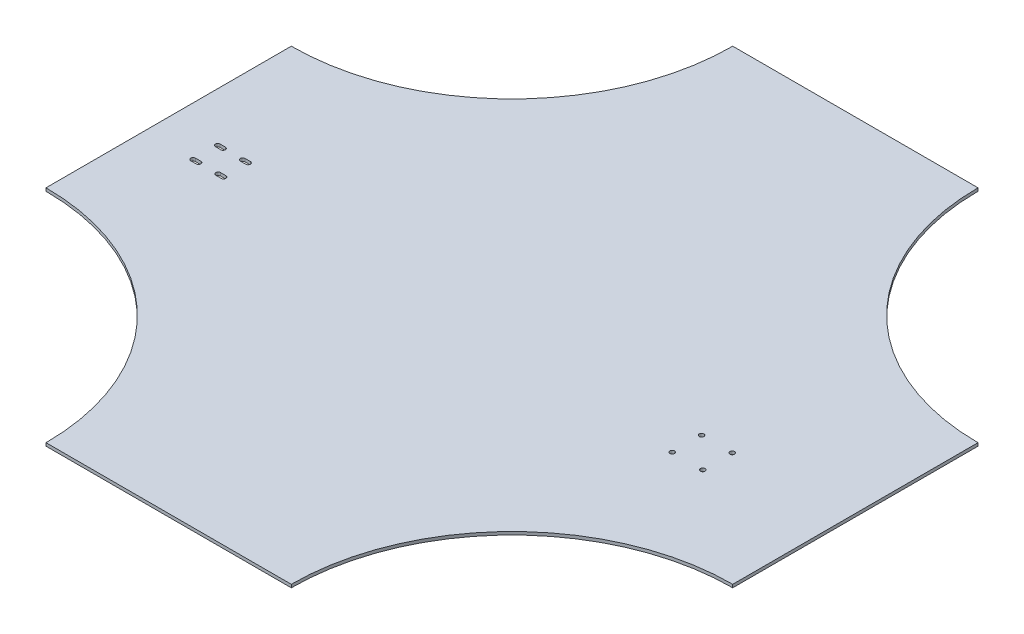
from build123d import *

# Parameters (mm, degrees)
BOSS_EXTRUDE1_DEPTH     = 3.175
CUT_EXTRUDE1_DEPTH      = 503.904365287
CUT_EXTRUDE1_DEPTH_BACK = 503.904365287
SKETCH4_R               = 2.413
CUT_EXTRUDE2_DEPTH      = 503.904365287


with BuildPart() as part:
    # Sketch1 → Boss-Extrude1 (new body)
    with BuildSketch(Plane(origin=(0, 0, 0), x_dir=(1, 0, 0), z_dir=(0, 1, 0))):
        with BuildLine():
            Line((-127, -355.6), (127, -355.6))
            ThreePointArc((127, -355.6), (193.955389821, -193.955389821), (355.6, -127))
            Line((355.6, -127), (355.6, 127))
            ThreePointArc((355.6, 127), (193.955389821, 193.955389821), (127, 355.6))
            Line((127, 355.6), (-127, 355.6))
            ThreePointArc((-127, 355.6), (-193.955389821, 193.955389821), (-355.6, 127))
            Line((-355.6, 127), (-355.6, -127))
            ThreePointArc((-355.6, -127), (-193.955389821, -193.955389821), (-127, -355.6))
        make_face()
    extrude(amount=BOSS_EXTRUDE1_DEPTH)

    # Sketch2 → Cut-Extrude1 (cut, two sides: drawn at the far end of the back side and taken through both)
    with BuildSketch(Plane(origin=(0, 3.175, 0), x_dir=(1, 0, 0), z_dir=(0, 1, 0)).offset(-CUT_EXTRUDE1_DEPTH_BACK)):
        with BuildLine():
            Line((-304.8, 2.413), (-299.212, 2.413))
            ThreePointArc((-299.212, 2.413), (-296.799, 0), (-299.212, -2.413))
            Line((-299.212, -2.413), (-304.8, -2.413))
            ThreePointArc((-304.8, -2.413), (-307.213, 0), (-304.8, 2.413))
        make_face()
        with BuildLine():
            Line((-304.8, -22.987), (-299.212, -22.987))
            ThreePointArc((-299.212, -22.987), (-296.799, -25.4), (-299.212, -27.813))
            Line((-299.212, -27.813), (-304.8, -27.813))
            ThreePointArc((-304.8, -27.813), (-307.213, -25.4), (-304.8, -22.987))
        make_face()
        with BuildLine():
            Line((-278.892, -2.413), (-273.304, -2.413))
            ThreePointArc((-273.304, -2.413), (-270.891, 0), (-273.304, 2.413))
            Line((-273.304, 2.413), (-278.892, 2.413))
            ThreePointArc((-278.892, 2.413), (-281.305, 0), (-278.892, -2.413))
        make_face()
        with BuildLine():
            Line((-278.892, -22.987), (-273.304, -22.987))
            ThreePointArc((-273.304, -22.987), (-270.891, -25.4), (-273.304, -27.813))
            Line((-273.304, -27.813), (-278.892, -27.813))
            ThreePointArc((-278.892, -27.813), (-281.305, -25.4), (-278.892, -22.987))
        make_face()
    extrude(amount=CUT_EXTRUDE1_DEPTH + CUT_EXTRUDE1_DEPTH_BACK, mode=Mode.SUBTRACT)

    # Sketch4 → Cut-Extrude2 (cut, through all)
    with BuildSketch(Plane(origin=(0, 3.175, 0), x_dir=(1, 0, 0), z_dir=(0, 1, 0))):
        with Locations((237.49, -9.430177049)):
            Circle(SKETCH4_R)
        with Locations((205.74, -9.430177049)):
            Circle(SKETCH4_R)
        with Locations((237.49, -39.910177049)):
            Circle(SKETCH4_R)
        with Locations((205.74, -39.910177049)):
            Circle(SKETCH4_R)
    extrude(amount=-CUT_EXTRUDE2_DEPTH, mode=Mode.SUBTRACT)


solid = part.part
